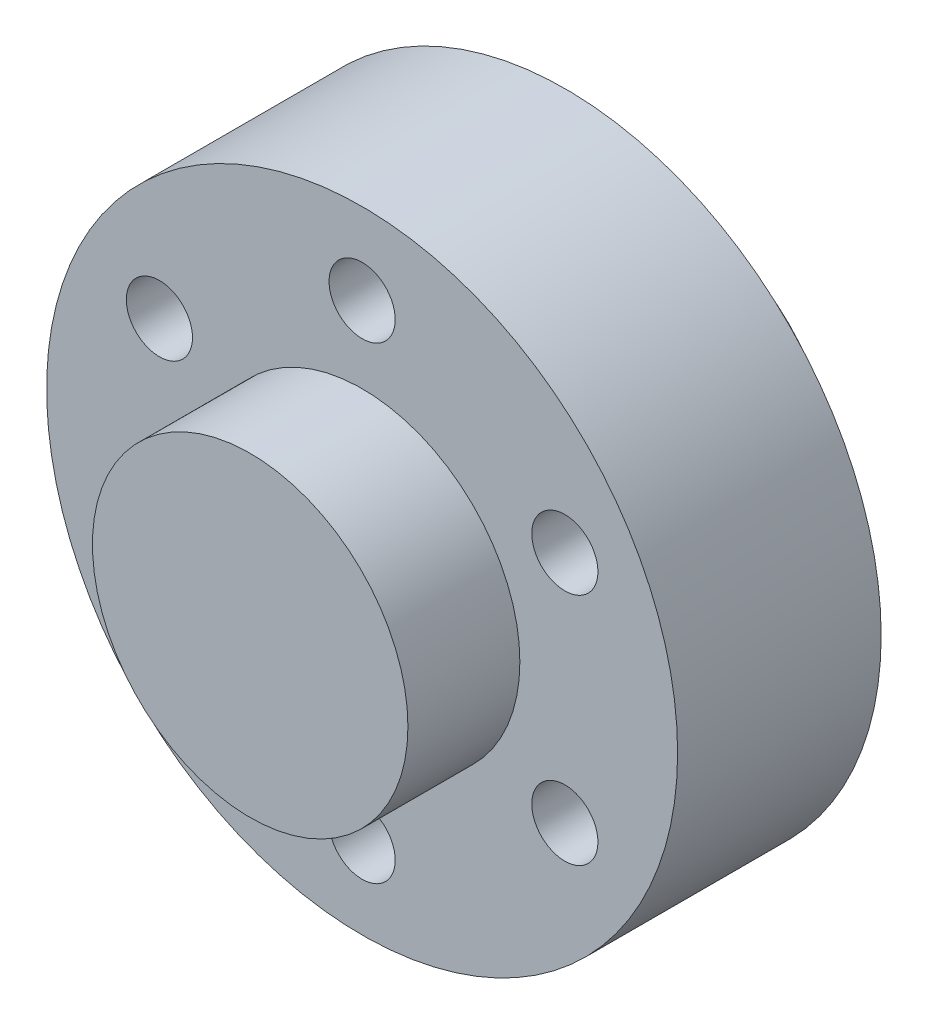
from build123d import *

# Parameters (mm, degrees)
SKETCH2_R           = 15.5
SKETCH2_R_2         = 1.625
BOSS_EXTRUDE1_DEPTH = 10
SKETCH3_R           = 7.75
BOSS_EXTRUDE2_DEPTH = 5.5
BOSS_EXTRUDE4_START = 5.5
SKETCH6_R           = 7.75
BOSS_EXTRUDE4_DEPTH = 5.5
SKETCH7_R           = 2
BOSS_EXTRUDE5_DEPTH = 1
FILLET2_R           = 0.05
CUT_EXTRUDE1_DEPTH  = 11


with BuildPart() as part:
    # Sketch2 → Boss-Extrude1 (new body)
    with BuildSketch(Plane.XY):
        Circle(SKETCH2_R)
        with Locations((0, -11.5)):
            Circle(SKETCH2_R_2, mode=Mode.SUBTRACT)
        with Locations((-9.959292144, -5.75)):
            Circle(SKETCH2_R_2, mode=Mode.SUBTRACT)
        with Locations((9.959292144, -5.75)):
            Circle(SKETCH2_R_2, mode=Mode.SUBTRACT)
        with Locations((-9.959292144, 5.75)):
            Circle(SKETCH2_R_2, mode=Mode.SUBTRACT)
        with Locations((0, 11.5)):
            Circle(SKETCH2_R_2, mode=Mode.SUBTRACT)
        with Locations((9.959292144, 5.75)):
            Circle(SKETCH2_R_2, mode=Mode.SUBTRACT)
    extrude(amount=BOSS_EXTRUDE1_DEPTH)

    # Sketch3 → Boss-Extrude2 (add)
    with BuildSketch(Plane.XY.offset(10)):
        Circle(SKETCH3_R)
    extrude(amount=BOSS_EXTRUDE2_DEPTH)

    # Sketch6 → Boss-Extrude4 (add)
    with BuildSketch(Plane(origin=(0, 0, 0), x_dir=(-1, 0, 0), z_dir=(0, 0, -1)).offset(BOSS_EXTRUDE4_START)):
        Circle(SKETCH6_R)
    extrude(amount=-BOSS_EXTRUDE4_DEPTH)

    # Sketch7 → Boss-Extrude5 (add)
    with BuildSketch(Plane(origin=(0, 0, -5.5), x_dir=(-1, 0, 0), z_dir=(0, 0, -1))):
        Circle(SKETCH7_R)
    extrude(amount=BOSS_EXTRUDE5_DEPTH)

    # Fillet2
    fillet2_edges = [part.edges().sort_by_distance(p)[0] for p in [
        (2, 0, -6.5),
    ]]
    fillet(fillet2_edges, radius=FILLET2_R)

    # Sketch9 → Cut-Extrude1 (cut)
    with BuildSketch(Plane(origin=(0, 0, -6.5), x_dir=(-1, 0, 0), z_dir=(0, 0, -1))):
        with BuildLine():
            Line((-1.224744871, 1.25), (1.224744871, 1.25))
            ThreePointArc((1.224744871, 1.25), (0, -1.75), (-1.224744871, 1.25))
        make_face()
    extrude(amount=-CUT_EXTRUDE1_DEPTH, mode=Mode.SUBTRACT)


solid = part.part
